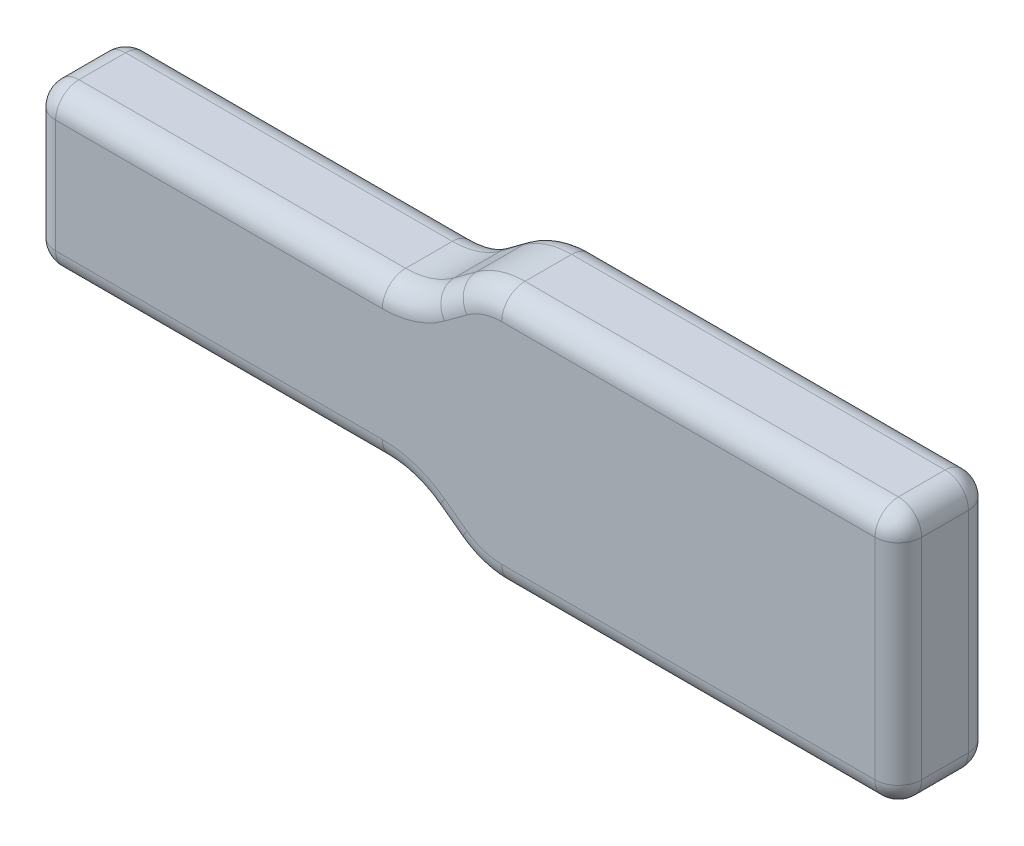
from build123d import *

# Parameters (mm, degrees)
BOSS_EXTRUDE2_DEPTH = 8
SHELL1_START        = 1
SHELL1_DEPTH        = 6
SKETCH5_W           = 6
SKETCH5_H           = 9.7
BOSS_EXTRUDE4_DEPTH = 1
FILLET1_R           = 2


# Read off the part's stored shape, not the designer's step: Shell1
with BuildPart() as part:
    # Sketch2 → Boss-Extrude2 (new body)
    with BuildSketch(Plane.XY):
        with BuildLine():
            Line((0, 20), (-32, 20))
            ThreePointArc((-32, 20), (-34.188489303, 19.649098779), (-36.157566157, 18.631575592))
            Line((-36.157566157, 18.631575592), (-38.071731179, 17.218424408))
            ThreePointArc((-38.071731179, 17.218424408), (-40.040808034, 16.200901221), (-42.229297337, 15.85))
            Line((-42.229297337, 15.85), (-70.229297337, 15.85))
            ThreePointArc((-70.229297337, 15.85), (-71.643510899, 15.264213562), (-72.229297337, 13.85))
            Line((-72.229297337, 13.85), (-72.229297337, 4.15))
            ThreePointArc((-72.229297337, 4.15), (-71.643510899, 2.735786438), (-70.229297337, 2.15))
            Line((-70.229297337, 2.15), (-42.229297337, 2.15))
            ThreePointArc((-42.229297337, 2.15), (-40.040808034, 1.799098779), (-38.071731179, 0.781575592))
            Line((-38.071731179, 0.781575592), (-36.157566157, -0.631575592))
            ThreePointArc((-36.157566157, -0.631575592), (-34.188489303, -1.649098779), (-32, -2))
            Line((-32, -2), (0, -2))
            ThreePointArc((0, -2), (1.414213562, -1.414213562), (2, 0))
            Line((2, 0), (2, 18))
            ThreePointArc((2, 18), (1.414213562, 19.414213562), (0, 20))
        make_face()
    extrude(amount=BOSS_EXTRUDE2_DEPTH)

    # Shell1 outline → Shell1 (cut)
    with BuildSketch(Plane.XY.offset(SHELL1_START)):
        with BuildLine():
            Line((-71.229297337, 13.85), (-72.229297337, 13.85))
            Line((-72.229297337, 13.85), (-72.229297337, 4.15))
            Line((-72.229297337, 4.15), (-71.229297337, 4.15))
            ThreePointArc((-71.229297337, 4.15), (-70.936404118, 3.442893219), (-70.229297337, 3.15))
            Line((-70.229297337, 3.15), (-42.229297337, 3.15))
            ThreePointArc((-42.229297337, 3.15), (-39.728166705, 2.748970033), (-37.477793157, 1.586086391))
            Line((-37.477793157, 1.586086391), (-35.563628135, 0.172935207))
            ThreePointArc((-35.563628135, 0.172935207), (-33.875847974, -0.699227525), (-32, -1))
            Line((-32, -1), (0, -1))
            ThreePointArc((0, -1), (0.707106781, -0.707106781), (1, 0))
            Line((1, 0), (1, 18))
            ThreePointArc((1, 18), (0.707106781, 18.707106781), (0, 19))
            Line((0, 19), (-32, 19))
            ThreePointArc((-32, 19), (-33.875847974, 18.699227525), (-35.563628135, 17.827064793))
            Line((-35.563628135, 17.827064793), (-37.477793157, 16.413913609))
            ThreePointArc((-37.477793157, 16.413913609), (-39.728166705, 15.251029967), (-42.229297337, 14.85))
            Line((-42.229297337, 14.85), (-70.229297337, 14.85))
            ThreePointArc((-70.229297337, 14.85), (-70.936404118, 14.557106781), (-71.229297337, 13.85))
        make_face()
    extrude(amount=SHELL1_DEPTH, mode=Mode.SUBTRACT)

    # Sketch5 → Boss-Extrude4 (add)
    with BuildSketch(Plane.ZY.offset(72.229297337)):
        with Locations((4, 9)):
            Rectangle(SKETCH5_W, SKETCH5_H)
    extrude(amount=-BOSS_EXTRUDE4_DEPTH)

    # Fillet1
    fillet1_edges = [part.edges().sort_by_distance(p)[0] for p in [
        (1.414213562, -1.414213562, 8),
        (2, 9, 8),
        (-37.114648668, 0.075, 0),
        (-40.040808034, 1.799098779, 0),
        (-56.229297337, 2.15, 0),
        (-71.643510899, 2.735786438, 0),
        (-72.229297337, 9, 0),
        (1.414213562, 19.414213562, 8),
        (-71.643510899, 15.264213562, 0),
        (-56.229297337, 15.85, 0),
        (-40.040808034, 16.200901221, 0),
        (-37.114648668, 17.925, 0),
        (-34.188489303, 19.649098779, 0),
        (-16, 20, 0),
        (1.414213562, 19.414213562, 0),
        (2, 9, 0),
        (-16, 20, 8),
        (1.414213562, -1.414213562, 0),
        (-16, -2, 0),
        (-34.188489303, -1.649098779, 0),
        (-34.188489303, 19.649098779, 8),
        (-37.114648668, 17.925, 8),
        (-40.040808034, 16.200901221, 8),
        (-56.229297337, 15.85, 8),
        (-71.643510899, 15.264213562, 8),
        (-72.229297337, 9, 8),
        (-34.188489303, -1.649098779, 8),
        (-71.643510899, 2.735786438, 8),
        (-56.229297337, 2.15, 8),
        (-40.040808034, 1.799098779, 8),
        (-37.114648668, 0.075, 8),
        (-16, -2, 8),
    ]]
    fillet(fillet1_edges, radius=FILLET1_R)


solid = part.part
